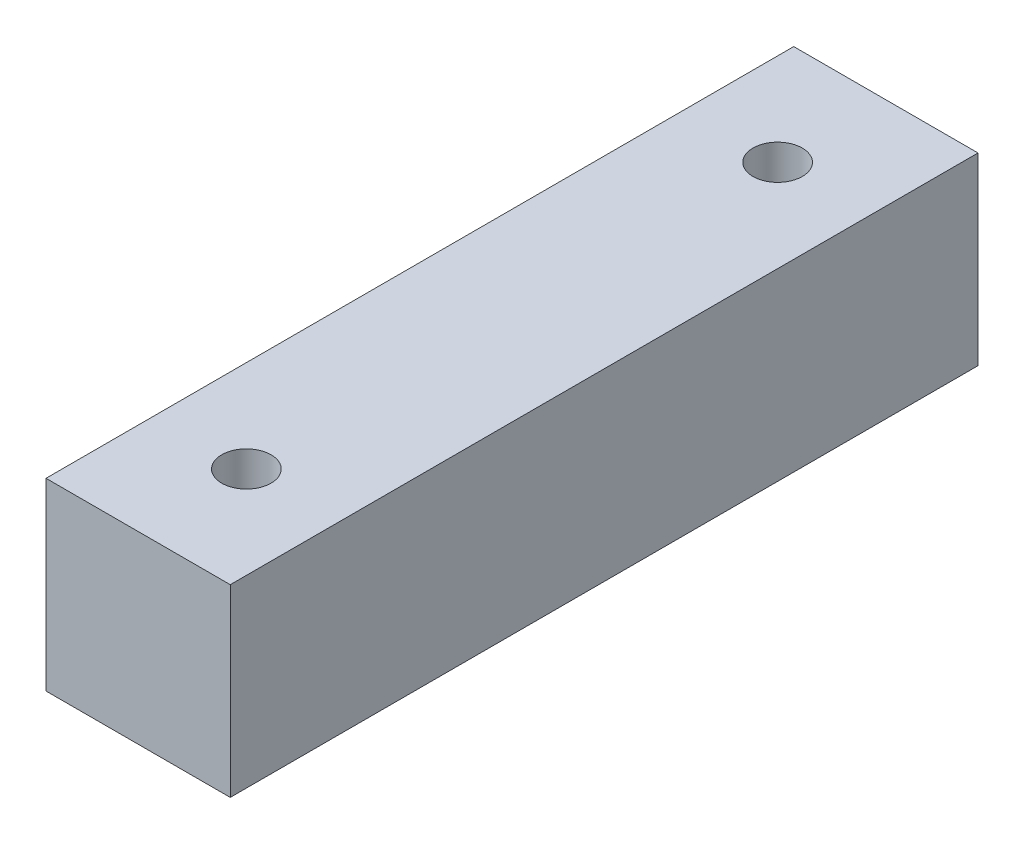
from build123d import *

# Parameters (mm, degrees)
SKETCH1_W           = 12.7
SKETCH1_H           = 12.7
BOSS_EXTRUDE1_DEPTH = 51.53914
SKETCH2_R           = 1.7
CUT_EXTRUDE1_DEPTH  = 54.459287799


with BuildPart() as part:
    # Sketch1 → Boss-Extrude1 (new body)
    with BuildSketch(Plane.XY):
        Rectangle(SKETCH1_W, SKETCH1_H)
    extrude(amount=BOSS_EXTRUDE1_DEPTH)

    # Sketch2 → Cut-Extrude1 (cut, through all)
    with BuildSketch(Plane.XZ.offset(6.35)):
        with Locations((0, 7.46125)):
            Circle(SKETCH2_R)
        with Locations((0, 44.07789)):
            Circle(SKETCH2_R)
    extrude(amount=-CUT_EXTRUDE1_DEPTH, mode=Mode.SUBTRACT)


solid = part.part
